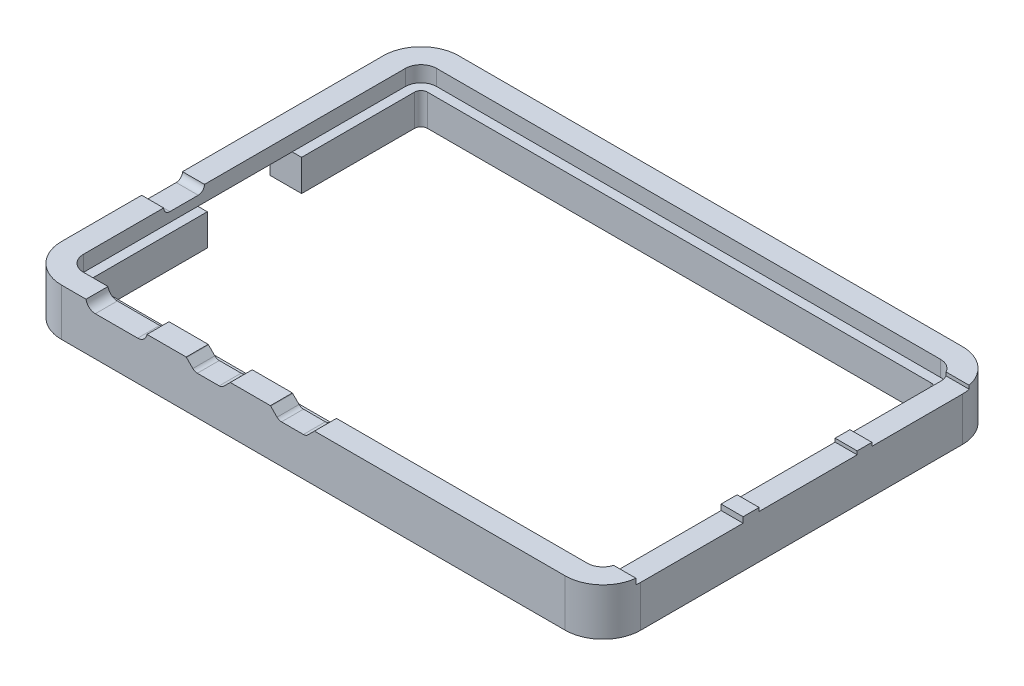
from build123d import *

# Parameters (mm, degrees)
EXTRUDE_THIN1_DEPTH      = 2.5
EXTRUDE_THIN1_DEPTH_BACK = 5
EXTRUDE_THIN2_START      = -5
EXTRUDE_THIN2_DEPTH      = 5
CUT_EXTRUDE3_DEPTH       = 76.51403843
CUT_EXTRUDE3_DEPTH_BACK  = 1
CUT_EXTRUDE4_START       = -0.20682878
CUT_EXTRUDE4_OUTLINE_W   = 17
CUT_EXTRUDE4_OUTLINE_H   = 0.9
CUT_EXTRUDE4_OUTLINE_W_2 = 15.6
CUT_EXTRUDE4_OUTLINE_H_2 = 0.55
CUT_EXTRUDE4_DEPTH       = 3.80682878
SKETCH10_W               = 10
SKETCH10_H               = 15
CUT_EXTRUDE6_DEPTH       = 57.113902021
CUT_EXTRUDE11_DEPTH      = 95.199363055
CUT_EXTRUDE11_DEPTH_BACK = 5


# Read off the part's stored shape, not the designer's step: Cut-Extrude4
with BuildPart() as part:
    # Sketch1 → Extrude-Thin1 (new, two sides: drawn at the far end of the back side and taken through both)
    with BuildSketch(Plane(origin=(0, 0, 0), x_dir=(1, 0, 0), z_dir=(0, 1, 0)).offset(-EXTRUDE_THIN1_DEPTH_BACK)):
        with BuildLine():
            Line((-46.05, 25.6), (-46.05, -25.6))
            ThreePointArc((-46.05, -25.6), (-44.292640687, -29.842640687), (-40.05, -31.6))
            Line((-40.05, -31.6), (40.1, -31.6))
            ThreePointArc((40.1, -31.6), (44.342640687, -29.842640687), (46.1, -25.6))
            Line((46.1, -25.6), (46.1, 25.6))
            ThreePointArc((46.1, 25.6), (44.342640687, 29.842640687), (40.1, 31.6))
            Line((40.1, 31.6), (-40.05, 31.6))
            ThreePointArc((-40.05, 31.6), (-44.292640687, 29.842640687), (-46.05, 25.6))
        make_face()
        with BuildLine():
            Line((-42.55, 25.6), (-42.55, -25.6))
            ThreePointArc((-42.55, -25.6), (-41.817766953, -27.367766953), (-40.05, -28.1))
            Line((-40.05, -28.1), (40.1, -28.1))
            ThreePointArc((40.1, -28.1), (41.867766953, -27.367766953), (42.6, -25.6))
            Line((42.6, -25.6), (42.6, 25.6))
            ThreePointArc((42.6, 25.6), (41.867766953, 27.367766953), (40.1, 28.1))
            Line((40.1, 28.1), (-40.05, 28.1))
            ThreePointArc((-40.05, 28.1), (-41.817766953, 27.367766953), (-42.55, 25.6))
        make_face(mode=Mode.SUBTRACT)
    extrude(amount=EXTRUDE_THIN1_DEPTH + EXTRUDE_THIN1_DEPTH_BACK)

    # Sketch1<3> → Extrude-Thin2 (add)
    with BuildSketch(Plane(origin=(0, 0, 0), x_dir=(1, 0, 0), z_dir=(0, 1, 0)).offset(EXTRUDE_THIN2_START)):
        with BuildLine():
            Line((-42.55, 25.6), (-42.55, -25.6))
            ThreePointArc((-42.55, -25.6), (-41.817766953, -27.367766953), (-40.05, -28.1))
            Line((-40.05, -28.1), (40.1, -28.1))
            ThreePointArc((40.1, -28.1), (41.867766953, -27.367766953), (42.6, -25.6))
            Line((42.6, -25.6), (42.6, 25.6))
            ThreePointArc((42.6, 25.6), (41.867766953, 27.367766953), (40.1, 28.1))
            Line((40.1, 28.1), (-40.05, 28.1))
            ThreePointArc((-40.05, 28.1), (-41.817766953, 27.367766953), (-42.55, 25.6))
        make_face()
        with BuildLine():
            Line((-41.05, 25.6), (-41.05, -25.6))
            ThreePointArc((-41.05, -25.6), (-40.757106781, -26.307106781), (-40.05, -26.6))
            Line((-40.05, -26.6), (40.1, -26.6))
            ThreePointArc((40.1, -26.6), (40.807106781, -26.307106781), (41.1, -25.6))
            Line((41.1, -25.6), (41.1, 25.6))
            ThreePointArc((41.1, 25.6), (40.807106781, 26.307106781), (40.1, 26.6))
            Line((40.1, 26.6), (-40.05, 26.6))
            ThreePointArc((-40.05, 26.6), (-40.757106781, 26.307106781), (-41.05, 25.6))
        make_face(mode=Mode.SUBTRACT)
    extrude(amount=EXTRUDE_THIN2_DEPTH)

    # Sketch5 → Cut-Extrude3 (cut, two sides: drawn at the far end of the back side and taken through both)
    with BuildSketch(Plane.XY.offset(28).offset(-CUT_EXTRUDE3_DEPTH_BACK)):
        with BuildLine():
            Line((-26.43, 3.5), (-36.17, 3.5))
            Line((-36.17, 3.5), (-36.17, 2.74))
            ThreePointArc((-36.17, 2.74), (-35.730660172, 1.679339828), (-34.67, 1.24))
            Line((-34.67, 1.24), (-27.93, 1.24))
            ThreePointArc((-27.93, 1.24), (-26.869339828, 1.679339828), (-26.43, 2.74))
            Line((-26.43, 2.74), (-26.43, 3.5))
        make_face()
        with BuildLine():
            Line((-12.954733256, 3.5), (-20.454733256, 3.5))
            Line((-20.454733256, 3.5), (-20.454733256, 3.157106781))
            ThreePointArc((-20.454733256, 3.157106781), (-20.378612788, 2.774423349), (-20.161840037, 2.45))
            Line((-20.161840037, 2.45), (-19.154733256, 1.442893219))
            ThreePointArc((-19.154733256, 1.442893219), (-18.830309907, 1.226120467), (-18.447626475, 1.15))
            Line((-18.447626475, 1.15), (-14.961840037, 1.15))
            ThreePointArc((-14.961840037, 1.15), (-14.579156605, 1.226120467), (-14.254733256, 1.442893219))
            Line((-14.254733256, 1.442893219), (-13.247626475, 2.45))
            ThreePointArc((-13.247626475, 2.45), (-13.030853723, 2.774423349), (-12.954733256, 3.157106781))
            Line((-12.954733256, 3.157106781), (-12.954733256, 3.5))
        make_face()
        with BuildLine():
            Line((0.445266744, 3.5), (-7.054733256, 3.5))
            Line((-7.054733256, 3.5), (-7.054733256, 3.157106781))
            ThreePointArc((-7.054733256, 3.157106781), (-6.978612788, 2.774423349), (-6.761840037, 2.45))
            Line((-6.761840037, 2.45), (-5.754733256, 1.442893219))
            ThreePointArc((-5.754733256, 1.442893219), (-5.430309907, 1.226120467), (-5.047626475, 1.15))
            Line((-5.047626475, 1.15), (-1.561840037, 1.15))
            ThreePointArc((-1.561840037, 1.15), (-1.179156605, 1.226120467), (-0.854733256, 1.442893219))
            Line((-0.854733256, 1.442893219), (0.152373525, 2.45))
            ThreePointArc((0.152373525, 2.45), (0.369146277, 2.774423349), (0.445266744, 3.157106781))
            Line((0.445266744, 3.157106781), (0.445266744, 3.5))
        make_face()
    extrude(amount=CUT_EXTRUDE3_DEPTH + CUT_EXTRUDE3_DEPTH_BACK, mode=Mode.SUBTRACT)

    # Cut-Extrude4 outline → Cut-Extrude4 (cut)
    with BuildSketch(Plane(origin=(42.5, 0, 0), x_dir=(0, 0, -1), z_dir=(1, 0, 0)).offset(CUT_EXTRUDE4_START)):
        with Locations((-17.8, 2.05)):
            Rectangle(CUT_EXTRUDE4_OUTLINE_W, CUT_EXTRUDE4_OUTLINE_H)
        with Locations((19, 2.225)):
            Rectangle(CUT_EXTRUDE4_OUTLINE_W_2, CUT_EXTRUDE4_OUTLINE_H_2)
        with Locations((1.05, 2.225)):
            Rectangle(CUT_EXTRUDE4_OUTLINE_W_2, CUT_EXTRUDE4_OUTLINE_H_2)
    extrude(amount=CUT_EXTRUDE4_DEPTH, mode=Mode.SUBTRACT)

    # Sketch10 → Cut-Extrude6 (cut, through all)
    with BuildSketch(Plane(origin=(0, 0, 0), x_dir=(1, 0, 0), z_dir=(0, 1, 0))):
        with Locations((-46.05, 0.1)):
            Rectangle(SKETCH10_W, SKETCH10_H)
    extrude(amount=-CUT_EXTRUDE6_DEPTH, mode=Mode.SUBTRACT)

    # Sketch11 → Cut-Extrude11 (cut, two sides: drawn at the far end of the back side and taken through both)
    with BuildSketch(Plane.ZY.offset(42.5).offset(-CUT_EXTRUDE11_DEPTH_BACK)):
        with BuildLine():
            ThreePointArc((6.35, 2.5), (6.642893219, 1.792893219), (7.35, 1.5))
            Line((7.35, 1.5), (11.85, 1.5))
            ThreePointArc((11.85, 1.5), (12.557106781, 1.792893219), (12.85, 2.5))
            Line((12.85, 2.5), (6.35, 2.5))
        make_face()
    extrude(amount=CUT_EXTRUDE11_DEPTH + CUT_EXTRUDE11_DEPTH_BACK, mode=Mode.SUBTRACT)


solid = part.part
